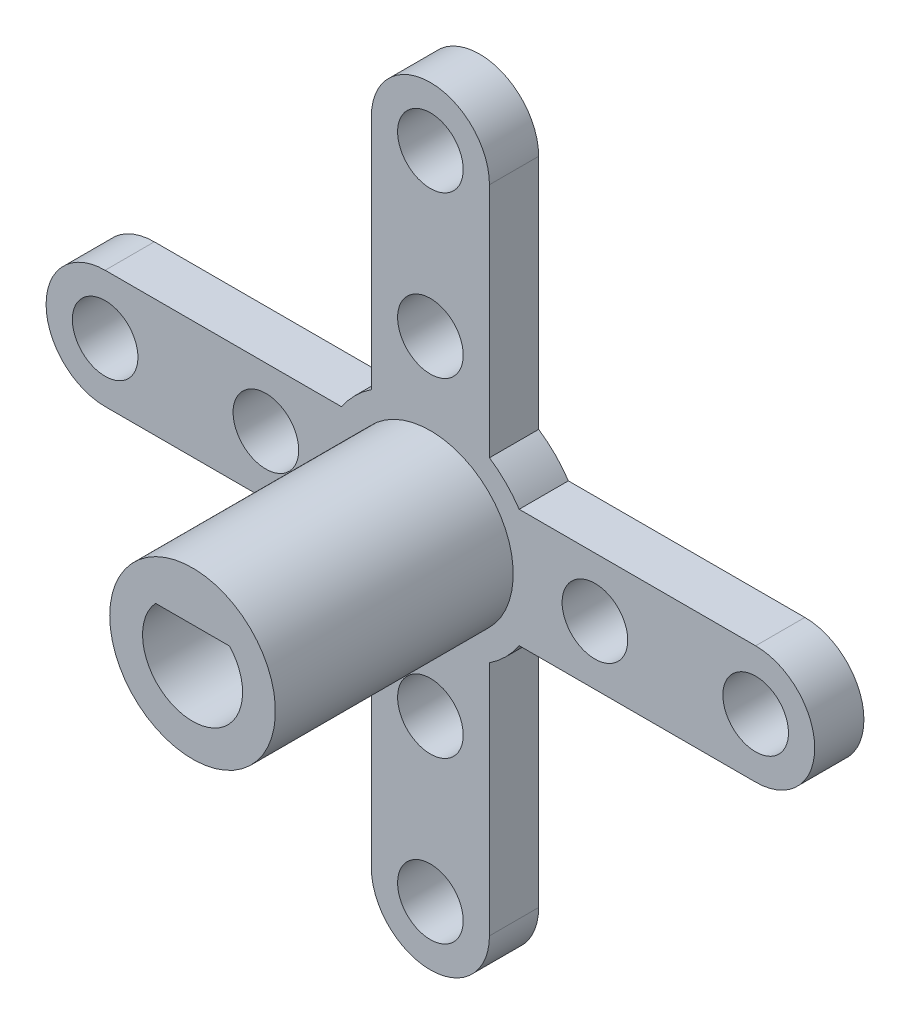
from build123d import *

# Parameters (mm, degrees)
SKETCH1_R           = 1
BOSS_EXTRUDE1_DEPTH = 1.5
CIRPATTERN1_COUNT   = 4
SKETCH3_R           = 2.525
BOSS_EXTRUDE3_DEPTH = 7.25


with BuildPart() as part:
    # Sketch1 → Boss-Extrude1 (new body)
    with BuildSketch(Plane.XY):
        with BuildLine():
            Line((1.8, 2.706011826), (1.8, 9.915))
            ThreePointArc((1.8, 9.915), (0, 11.715), (-1.8, 9.915))
            Line((-1.8, 9.915), (-1.8, 2.706011826))
            ThreePointArc((-1.8, 2.706011826), (0, -3.25), (1.8, 2.706011826))
        make_face()
        with Locations((0, 5.015)):
            Circle(SKETCH1_R, mode=Mode.SUBTRACT)
        with Locations((0, 9.915)):
            Circle(SKETCH1_R, mode=Mode.SUBTRACT)
    boss_extrude1 = extrude(amount=BOSS_EXTRUDE1_DEPTH)

    # CirPattern1: Boss-Extrude1 ×4 about axis
    cirpattern1_axis = Axis((0, 0, 1.5), (0, 0, 1))
    for i in range(1, CIRPATTERN1_COUNT):
        add(boss_extrude1.rotate(cirpattern1_axis, i * 360 / CIRPATTERN1_COUNT))

    # Sketch3 → Boss-Extrude3 (add)
    with BuildSketch(Plane.XY.offset(1.5)):
        Circle(SKETCH3_R)
        with BuildLine():
            Line((-1.129158979, 1.025), (1.129158979, 1.025))
            ThreePointArc((1.129158979, 1.025), (0, -1.525), (-1.129158979, 1.025))
        make_face(mode=Mode.SUBTRACT)
    extrude(amount=BOSS_EXTRUDE3_DEPTH)


solid = part.part
